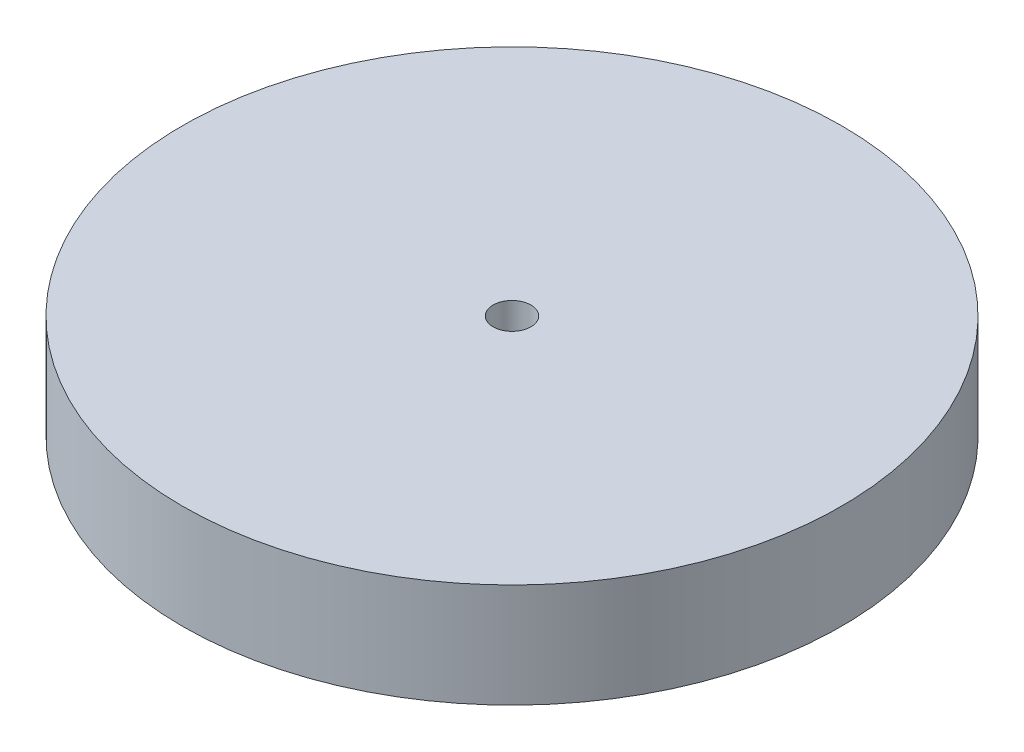
from build123d import *

# Parameters (mm, degrees)
SKETCH1_R           = 60.325
BOSS_EXTRUDE1_DEPTH = 19.05
SKETCH2_R           = 57.15
SKETCH2_R_2         = 55.5625
CUT_EXTRUDE1_DEPTH  = 3.175
SKETCH3_W           = 9.697234664
SKETCH3_H           = 6.926230082
CUT_EXTRUDE2_DEPTH  = 2.54
SKETCH4_R           = 3.463115041
CUT_EXTRUDE3_DEPTH  = 88.413464352


with BuildPart() as part:
    # Sketch1 → Boss-Extrude1 (new body)
    with BuildSketch(Plane(origin=(0, 0, 0), x_dir=(1, 0, 0), z_dir=(0, 1, 0))):
        Circle(SKETCH1_R)
    extrude(amount=BOSS_EXTRUDE1_DEPTH)

    # Sketch2 → Cut-Extrude1 (cut)
    with BuildSketch(Plane.XZ):
        Circle(SKETCH2_R)
        Circle(SKETCH2_R_2, mode=Mode.SUBTRACT)
    extrude(amount=-CUT_EXTRUDE1_DEPTH, mode=Mode.SUBTRACT)

    # Sketch3 → Cut-Extrude2 (cut)
    with BuildSketch(Plane.XZ):
        Rectangle(SKETCH3_W, SKETCH3_H)
    extrude(amount=-CUT_EXTRUDE2_DEPTH, mode=Mode.SUBTRACT)

    # Sketch4 → Cut-Extrude3 (cut, through all)
    with BuildSketch(Plane.XZ):
        Circle(SKETCH4_R)
    extrude(amount=-CUT_EXTRUDE3_DEPTH, mode=Mode.SUBTRACT)


solid = part.part
